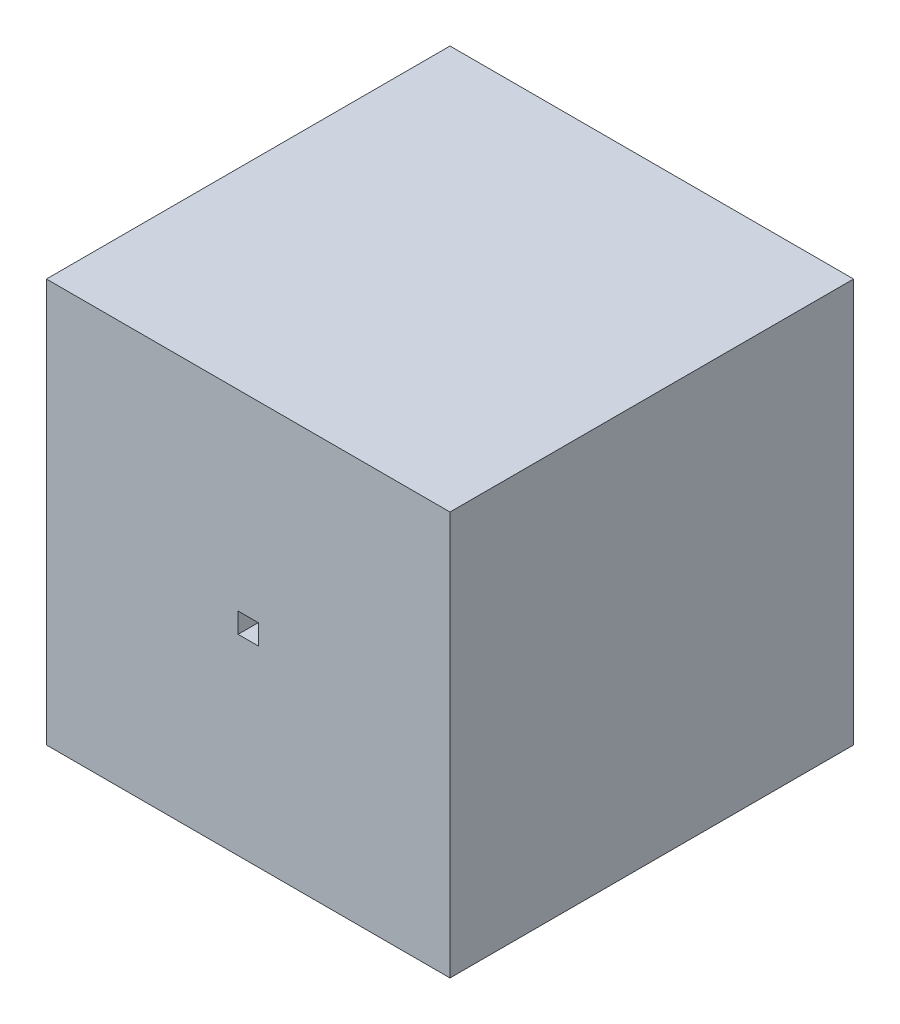
from build123d import *

# Parameters (mm, degrees)
CROQUIS1_W              = 100
CROQUIS1_H              = 100
SALIENTE_EXTRUIR1_DEPTH = 100
CROQUIS2_W              = 5
CROQUIS2_H              = 5
CORTAR_EXTRUIR1_DEPTH   = 123.474487139


with BuildPart() as part:
    # Croquis1 → Saliente-Extruir1 (new body)
    with BuildSketch(Plane.XY):
        Rectangle(CROQUIS1_W, CROQUIS1_H)
    extrude(amount=SALIENTE_EXTRUIR1_DEPTH)

    # Croquis2 → Cortar-Extruir1 (cut, through all)
    with BuildSketch(Plane(origin=(0, 0, 0), x_dir=(-1, 0, 0), z_dir=(0, 0, -1))):
        Rectangle(CROQUIS2_W, CROQUIS2_H)
    extrude(amount=-CORTAR_EXTRUIR1_DEPTH, mode=Mode.SUBTRACT)


solid = part.part
